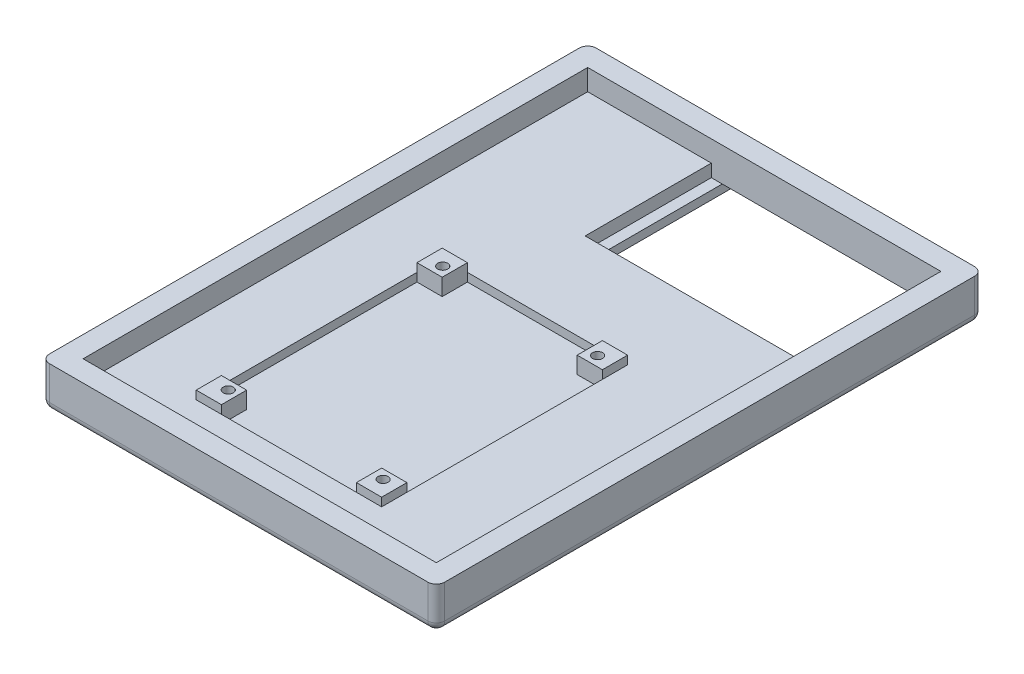
from build123d import *

# Parameters (mm, degrees)
SKETCH1_W           = 94
SKETCH1_H           = 130
BOSS_EXTRUDE1_DEPTH = 5
SKETCH2_W           = 94
SKETCH2_H           = 130
SKETCH2_W_2         = 84
SKETCH2_H_2         = 120
BOSS_EXTRUDE2_DEPTH = 5
FILLET1_R           = 2
SKETCH3_W           = 44.1
SKETCH3_H           = 58.5
CUT_EXTRUDE1_DEPTH  = 2
SKETCH5_W           = 6
SKETCH5_H           = 6
BOSS_EXTRUDE4_DEPTH = 4
SKETCH7_R           = 1.20000014
CUT_EXTRUDE2_DEPTH  = 3
SKETCH8_W           = 54.6
SKETCH8_H           = 30
CUT_EXTRUDE3_DEPTH  = 3
SKETCH9_W           = 49.4
SKETCH9_H           = 27
CUT_EXTRUDE4_DEPTH  = 2
SKETCH10_W          = 49.4
SKETCH10_H          = 6.619549161
CUT_EXTRUDE5_DEPTH  = 2
SKETCH11_W          = 5
SKETCH11_H          = 1
CUT_EXTRUDE6_DEPTH  = 3


with BuildPart() as part:
    # Sketch1 → Boss-Extrude1 (new body)
    with BuildSketch(Plane(origin=(0, 0, 0), x_dir=(1, 0, 0), z_dir=(0, 1, 0))):
        with Locations((47, 65)):
            Rectangle(SKETCH1_W, SKETCH1_H)
    extrude(amount=BOSS_EXTRUDE1_DEPTH)

    # Sketch2 → Boss-Extrude2 (add)
    with BuildSketch(Plane(origin=(0, 5, 0), x_dir=(1, 0, 0), z_dir=(0, 1, 0))):
        with Locations((47, 65)):
            Rectangle(SKETCH2_W, SKETCH2_H)
        with Locations((47, 65)):
            Rectangle(SKETCH2_W_2, SKETCH2_H_2, mode=Mode.SUBTRACT)
    extrude(amount=BOSS_EXTRUDE2_DEPTH)

    # Fillet1
    fillet1_edges = [part.edges().sort_by_distance(p)[0] for p in [
        (0, 5, -130),
        (0, 5, 0),
        (94, 5, 0),
        (47, 0, 0),
        (0, 0, -65),
        (94, 0, -65),
        (47, 0, -130),
        (94, 5, -130),
    ]]
    fillet(fillet1_edges, radius=FILLET1_R)

    # Sketch3 → Cut-Extrude1 (cut)
    with BuildSketch(Plane(origin=(0, 5, 0), x_dir=(1, 0, 0), z_dir=(0, 1, 0))):
        with Locations((43.95, 44.25)):
            Rectangle(SKETCH3_W, SKETCH3_H)
    extrude(amount=-CUT_EXTRUDE1_DEPTH, mode=Mode.SUBTRACT)

    # Sketch5 → Boss-Extrude4 (add)
    with BuildSketch(Plane(origin=(0, 3, 0), x_dir=(1, 0, 0), z_dir=(0, 1, 0))):
        with Locations((24.9, 70.5)):
            Rectangle(SKETCH5_W, SKETCH5_H)
        with Locations((63, 70.5)):
            Rectangle(SKETCH5_W, SKETCH5_H)
        with Locations((63, 18)):
            Rectangle(SKETCH5_W, SKETCH5_H)
        with Locations((24.9, 18)):
            Rectangle(SKETCH5_W, SKETCH5_H)
    extrude(amount=BOSS_EXTRUDE4_DEPTH)

    # Sketch7 → Cut-Extrude2 (cut)
    with BuildSketch(Plane(origin=(0, 7, 0), x_dir=(1, 0, 0), z_dir=(0, 1, 0))):
        with Locations((25.684600549, 69.839000092)):
            Circle(SKETCH7_R)
        with Locations((62.514600549, 69.839000092)):
            Circle(SKETCH7_R)
        with Locations((62.514600549, 18.835800092)):
            Circle(SKETCH7_R)
        with Locations((25.684600549, 18.835800092)):
            Circle(SKETCH7_R)
    extrude(amount=-CUT_EXTRUDE2_DEPTH, mode=Mode.SUBTRACT)

    # Sketch8 → Cut-Extrude3 (cut)
    with BuildSketch(Plane(origin=(0, 5, 0), x_dir=(1, 0, 0), z_dir=(0, 1, 0))):
        with Locations((61.7, 110)):
            Rectangle(SKETCH8_W, SKETCH8_H)
    extrude(amount=-CUT_EXTRUDE3_DEPTH, mode=Mode.SUBTRACT)

    # Sketch9 → Cut-Extrude4 (cut)
    with BuildSketch(Plane(origin=(0, 2, 0), x_dir=(1, 0, 0), z_dir=(0, 1, 0))):
        with Locations((61.7, 110)):
            Rectangle(SKETCH9_W, SKETCH9_H)
    extrude(amount=-CUT_EXTRUDE4_DEPTH, mode=Mode.SUBTRACT)

    # Sketch10 → Cut-Extrude5 (cut)
    with BuildSketch(Plane.XZ):
        with Locations((61.7, -126.809774581)):
            Rectangle(SKETCH10_W, SKETCH10_H)
    extrude(amount=-CUT_EXTRUDE5_DEPTH, mode=Mode.SUBTRACT)

    # Sketch11 → Cut-Extrude6 (cut)
    with BuildSketch(Plane(origin=(0, 0, -96.5), x_dir=(-1, 0, 0), z_dir=(0, 0, -1))):
        with Locations((-61.7, 1)):
            Rectangle(SKETCH11_W, SKETCH11_H)
    extrude(amount=-CUT_EXTRUDE6_DEPTH, mode=Mode.SUBTRACT)


solid = part.part
